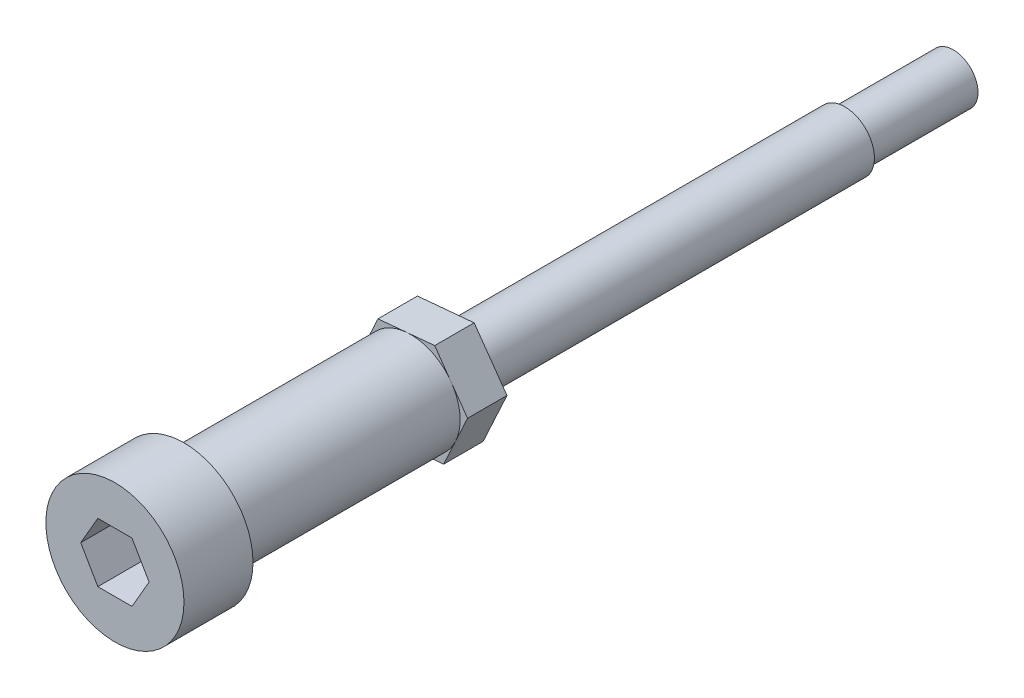
from build123d import *

# Parameters (mm, degrees)
ENL_V_MAT_EXTRU_1_DEPTH = 10
BOSS_EXTRU_1_DEPTH      = 8


with BuildPart() as part:
    # Esquisse2 → Base-Révolution (revolve)
    with BuildSketch(Plane(origin=(0, 0, 0), x_dir=(0, 0, -1), z_dir=(1, 0, 0))):
        Polygon((0, 0), (0, 14), (14, 14), (14, 10), (60, 10), (60, 6), (148, 6), (148, 5), (170, 5), (170, 0), align=None)
    revolve(axis=Axis((0, 0, 67), (0, 0, -1)))

    # Esquisse3 → Enlèv. mat.-Extru.1 (cut)
    with BuildSketch(Plane.XY):
        Polygon((6.92820323, 0), (3.464101615, 6), (-3.464101615, 6), (-6.92820323, 0), (-3.464101615, -6), (3.464101615, -6), align=None)
    extrude(amount=-ENL_V_MAT_EXTRU_1_DEPTH, mode=Mode.SUBTRACT)

    # Esquisse7 → Boss.-Extru.1 (add)
    with BuildSketch(Plane(origin=(0, 0, -60), x_dir=(-1, 0, 0), z_dir=(0, 0, -1))):
        Polygon((4.838867031, -10.484211901), (11.499027361, -1.051524176), (6.660160329, 9.432687725), (-4.838867031, 10.484211901), (-11.499027361, 1.051524176), (-6.660160329, -9.432687725), align=None)
    extrude(amount=BOSS_EXTRU_1_DEPTH)


solid = part.part
